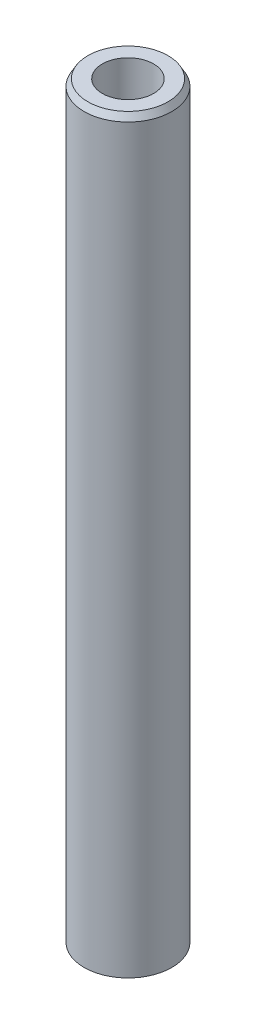
from build123d import *
from OCP.BRepFilletAPI import BRepFilletAPI_MakeChamfer

# Parameters (mm, degrees)
SKETCH1_R           = 35
BOSS_EXTRUDE1_DEPTH = 600
SKETCH2_R           = 20.480474544
CUT_EXTRUDE1_DEPTH  = 603.038204768
CHAMFER1_SIZE       = 5.243875602
CHAMFER1_SIZE2      = 3.02755299


with BuildPart() as part:
    # Sketch1 → Boss-Extrude1 (new body)
    with BuildSketch(Plane(origin=(0, 0, 0), x_dir=(1, 0, 0), z_dir=(0, 1, 0))):
        Circle(SKETCH1_R)
    extrude(amount=BOSS_EXTRUDE1_DEPTH)

    # Sketch2 → Cut-Extrude1 (cut, through all)
    with BuildSketch(Plane(origin=(0, 0, 0), x_dir=(1, 0, 0), z_dir=(0, 1, 0))):
        Circle(SKETCH2_R)
    extrude(amount=CUT_EXTRUDE1_DEPTH, mode=Mode.SUBTRACT)

    # Chamfer1: one chamfer whose edges measure the first distance from different faces: ONE call of the kernel's chamfer builder (chamfer() names one face for all edges)
    chamfer1_edges_1 = [part.edges().sort_by_distance(p)[0] for p in [
        (-35, 600, 0),
    ]]
    chamfer1_side_1 = [part.faces().sort_by_distance(p)[0] for p in [
        (-35, 300, 0),
    ]]
    chamfer1_edges_2 = [part.edges().sort_by_distance(p)[0] for p in [
        (-35, 0, 0),
    ]]
    chamfer1_side_2 = [part.faces().sort_by_distance(p)[0] for p in [
        (-34.010050506, 0, 0),
    ]]
    chamfer1 = BRepFilletAPI_MakeChamfer(part.part.solid().wrapped)
    for e in chamfer1_edges_1:
        chamfer1.Add(CHAMFER1_SIZE, CHAMFER1_SIZE2, e.wrapped, chamfer1_side_1[0].wrapped)  # the first distance lies on this face
    for e in chamfer1_edges_2:
        chamfer1.Add(CHAMFER1_SIZE, CHAMFER1_SIZE2, e.wrapped, chamfer1_side_2[0].wrapped)  # the first distance lies on this face
    add(Compound.cast(chamfer1.Shape()), mode=Mode.REPLACE)


solid = part.part
